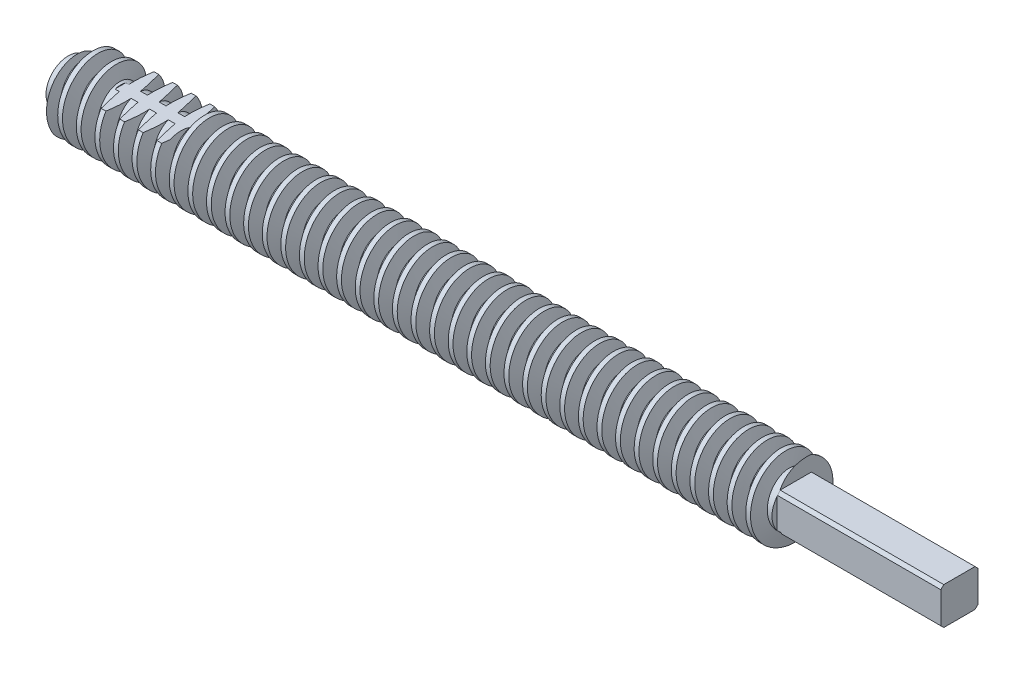
from build123d import *

# Parameters (mm, degrees)
SKETCH1_W          = 76.2
SKETCH1_H          = 3.175
CUT_SWEEP1_PITCH   = 1.5875
SKETCH6_W          = 6.096
SKETCH6_H          = 2.032
CUT_EXTRUDE1_DEPTH = 6.35
SKETCH7_R          = 3.175
CUT_EXTRUDE2_DEPTH = 13.97


with BuildPart() as part:
    # Sketch1 → Revolve1 (revolve)
    with BuildSketch(Plane.XY):
        with Locations((-31.75, 1.5875)):
            Rectangle(SKETCH1_W, SKETCH1_H)
    revolve(axis=Axis((6.35, 0, 0), (-1, 0, 0)))

    # Cut-Sweep1: arcs per turn and ends read off the stored shape
    # Cut-Sweep1: the profile of Sketch3 profile screwed along a right-hand helix through 40 turns, 8 arcs to a turn; built about Z, then put on its axis
    cut_sweep1_z = Axis((0, 0, 0), (0, 0, 1))
    cut_sweep1_corners = [(3.1753, 0, -0.955350567), (2.032, 0, -0.659673083), (2.032, 0, -0.071205883), (3.1753, 0, 0.224471602)]
    with BuildLine(mode=Mode.PRIVATE) as cut_sweep1_profile:
        Line(cut_sweep1_corners[0], cut_sweep1_corners[1])
        Line(cut_sweep1_corners[1], cut_sweep1_corners[2])
        Line(cut_sweep1_corners[2], cut_sweep1_corners[3])
        Line(cut_sweep1_corners[3], cut_sweep1_corners[0])
    cut_sweep1_cap = Face(cut_sweep1_profile.wire())
    cut_sweep1_turn_angles = [0, 22.5, 45, 67.5, 90, 112.5, 135, 157.5, 180, 202.5, 225, 247.5, 270, 292.5, 315, 337.5, 360]
    cut_sweep1_turn_weights = [1, 0.9238795325112867, 1, 0.9238795325112867, 1, 0.9238795325112867, 1, 0.9238795325112867, 1, 0.9238795325112867, 1, 0.9238795325112867, 1, 0.9238795325112867, 1, 0.9238795325112867, 1]
    cut_sweep1_turn_rails = [Edge.make_bspline([Vector(p[0], p[1], 0).rotate(cut_sweep1_z, cut_sweep1_turn_angles[k]) / cut_sweep1_turn_weights[k] + Vector(0, 0, p[2] + CUT_SWEEP1_PITCH * cut_sweep1_turn_angles[k] / 360) for k in range(17)], [0, 0, 0, 1, 1, 2, 2, 3, 3, 4, 4, 5, 5, 6, 6, 7, 7, 8, 8, 8], 2, cut_sweep1_turn_weights) for p in cut_sweep1_corners]
    cut_sweep1_turn_sides = [Face.make_surface_from_curves(cut_sweep1_turn_rails[p[0]], cut_sweep1_turn_rails[p[1]]) for p in [(0, 1), (1, 2), (2, 3), (3, 0)]]
    cut_sweep1 = Plane(origin=(-69.85, 0, 0), x_dir=(0, 0.7071067811865438, -0.7071067811865512), z_dir=(1, 0, 0)) * Solid(Shell([*[p.moved(Location((0, 0, CUT_SWEEP1_PITCH * i))) for i in range(40) for p in cut_sweep1_turn_sides], cut_sweep1_cap, cut_sweep1_cap.rotate(cut_sweep1_z, 14400).moved(Location((0, 0, CUT_SWEEP1_PITCH * 14400 / 360)))]))
    add(cut_sweep1, mode=Mode.SUBTRACT)

    # Sketch4 → Cut-Revolve1 (revolve, cut)
    with BuildSketch(Plane.XY, mode=Mode.PRIVATE) as cut_revolve1_sk:
        Polygon((-69.215, 1.978238833), (-69.723, 1.978238833), (-69.85, 1.660738833), (-69.85, 3.523202068), (-68.323015061, 3.523202068), align=None)
    revolve(cut_revolve1_sk.sketch.rotate(Axis((-71.928988702, 0.073238833, 0), (1, 0, 0)), 90), axis=Axis((-71.928988702, 0.073238833, 0), (1, 0, 0)), mode=Mode.SUBTRACT)

    # Sketch6 → Cut-Extrude1 (cut, symmetric)
    with BuildSketch(Plane.XY):
        with Locations((-62.23, 2.994238833)):
            Rectangle(SKETCH6_W, SKETCH6_H)
    extrude(amount=CUT_EXTRUDE1_DEPTH, both=True, mode=Mode.SUBTRACT)

    # Sketch7 → Cut-Extrude2 (cut)
    with BuildSketch(Plane(origin=(6.35, 0, 0), x_dir=(0, 0, -1), z_dir=(1, 0, 0))):
        Circle(SKETCH7_R)
        Polygon((-1.5875, -1.3335), (-1.5875, 1.3335), (-1.3335, 1.5875), (1.3335, 1.5875), (1.5875, 1.3335), (1.5875, -1.3335), (1.3335, -1.5875), (-1.3335, -1.5875), align=None, mode=Mode.SUBTRACT)
    extrude(amount=-CUT_EXTRUDE2_DEPTH, mode=Mode.SUBTRACT)


solid = part.part
